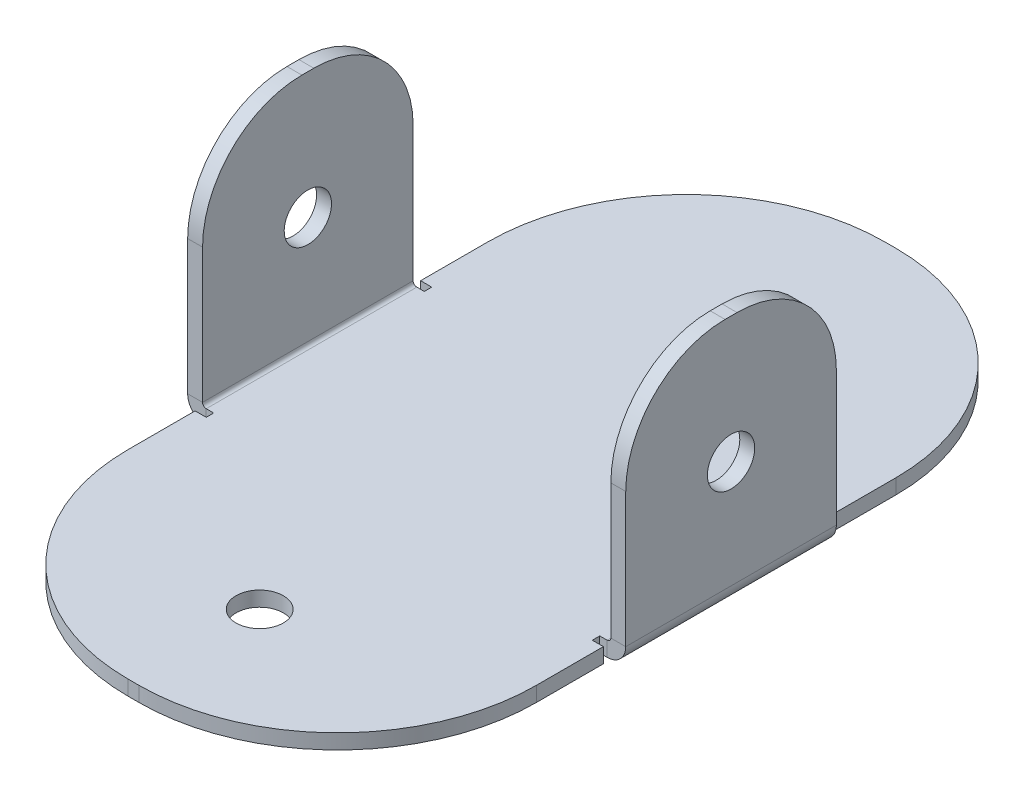
from build123d import *

# Parameters (mm, degrees)
SKETCH1_R                     = 4.7625
BASE_FLANGE1_DEPTH            = 3
EDGE_FLANGE2_STRIP_W          = 13.4732
EDGE_FLANGE2_STRIP_H          = 3
EDGE_FLANGE2_STRIP_CUT_DEPTH  = 42.4
EDGE_FLANGE2_RELIEF_W         = 14.9732
EDGE_FLANGE2_RELIEF_H         = 1.5
EDGE_FLANGE2_RELIEF_CUT_DEPTH = 3
EDGE_FLANGE2_DEPTH            = 42.4
EDGE_FLANGE2_START            = 3
EDGE_FLANGE2_PROFILE_R        = 4.7625
EDGE_FLANGE2_FLAT_DEPTH       = 3
EDGE_FLANGE3_STRIP_W          = 13.4732
EDGE_FLANGE3_STRIP_H          = 3
EDGE_FLANGE3_STRIP_CUT_DEPTH  = 42.4
EDGE_FLANGE3_RELIEF_W         = 14.9732
EDGE_FLANGE3_RELIEF_H         = 1.5
EDGE_FLANGE3_RELIEF_CUT_DEPTH = 3
EDGE_FLANGE3_DEPTH            = 42.4
EDGE_FLANGE3_START            = 3
EDGE_FLANGE3_PROFILE_R        = 4.7625
EDGE_FLANGE3_FLAT_DEPTH       = 3


# Sheet-metal steps are written as plain solids
with BuildPart() as part:
    # Sketch1 → Base-Flange1 (new body)
    with BuildSketch(Plane(origin=(0, 0, 0), x_dir=(1, 0, 0), z_dir=(0, 1, 0))):
        with BuildLine():
            Line((-1.1, 76.2), (1.1, 76.2))
            ThreePointArc((1.1, 76.2), (29.384271247, 64.484271247), (41.1, 36.2))
            Line((41.1, 36.2), (41.1, -36.2))
            ThreePointArc((41.1, -36.2), (29.384271247, -64.484271247), (1.1, -76.2))
            Line((1.1, -76.2), (-1.1, -76.2))
            ThreePointArc((-1.1, -76.2), (-29.384271247, -64.484271247), (-41.1, -36.2))
            Line((-41.1, -36.2), (-41.1, 36.2))
            ThreePointArc((-41.1, 36.2), (-29.384271247, 64.484271247), (-1.1, 76.2))
        make_face()
        with Locations(Location((0, -50.8, 0), (0, 0, 270))):
            Circle(SKETCH1_R, mode=Mode.SUBTRACT)
        with Locations(Location((0, 50.8, 0), (0, 0, 90))):
            Circle(SKETCH1_R, mode=Mode.SUBTRACT)
    extrude(amount=-BASE_FLANGE1_DEPTH)

    # Edge-Flange2 strip (across the edge) → Edge-Flange2 strip cut (cut)
    with BuildSketch(Plane(origin=(41.1, 0, 21.2), x_dir=(-1, 0, 0), z_dir=(0, 0, -1))):
        with Locations((-6, -1.5)):
            Rectangle(EDGE_FLANGE2_STRIP_W, EDGE_FLANGE2_STRIP_H)
    extrude(amount=EDGE_FLANGE2_STRIP_CUT_DEPTH, mode=Mode.SUBTRACT)

    # Edge-Flange2 relief (on the sheet) → Edge-Flange2 relief cut (cut)
    with BuildSketch(Plane(origin=(40.3634, 0, 21.2), x_dir=(-1, 0, 0), z_dir=(0, 1, 0))):
        with Locations((-5.9866, 0.75)):
            Rectangle(EDGE_FLANGE2_RELIEF_W, EDGE_FLANGE2_RELIEF_H)
        with Locations((-5.9866, -43.15)):
            Rectangle(EDGE_FLANGE2_RELIEF_W, EDGE_FLANGE2_RELIEF_H)
    extrude(amount=-EDGE_FLANGE2_RELIEF_CUT_DEPTH, mode=Mode.SUBTRACT)

    # Edge-Flange2 bend section (across the edge) → Edge-Flange2 (add)
    with BuildSketch(Plane(origin=(41.1, 0, 21.2), x_dir=(-1, 0, 0), z_dir=(0, 0, -1))):
        with BuildLine():
            Line((-3, 0.7366), (0, 0.7366))
            ThreePointArc((0, 0.7366), (0.215745145, 0.215745145), (0.7366, 0))
            Line((0.7366, 0), (0.7366, -3))
            ThreePointArc((0.7366, -3), (-1.905575199, -1.905575199), (-3, 0.7366))
        make_face()
    extrude(amount=EDGE_FLANGE2_DEPTH)

    # Edge-Flange2 profile (on flange) → Edge-Flange2 flat (add)
    with BuildSketch(Plane(origin=(41.1, 0, 0), x_dir=(0, 0, -1), z_dir=(1, 0, 0)).offset(EDGE_FLANGE2_START)):
        with BuildLine():
            Line((-21.2, 27.8), (-21.2, 0.7366))
            Line((-21.2, 0.7366), (21.2, 0.7366))
            Line((21.2, 0.7366), (21.2, 27.8))
            ThreePointArc((21.2, 27.8), (15.342135624, 41.942135624), (1.2, 47.8))
            Line((1.2, 47.8), (-1.2, 47.8))
            ThreePointArc((-1.2, 47.8), (-15.342135624, 41.942135624), (-21.2, 27.8))
        make_face()
        with Locations((0, 22.4)):
            Circle(EDGE_FLANGE2_PROFILE_R, mode=Mode.SUBTRACT)
    extrude(amount=-EDGE_FLANGE2_FLAT_DEPTH)

    # Edge-Flange3 strip (across the edge) → Edge-Flange3 strip cut (cut)
    with BuildSketch(Plane(origin=(-41.1, 0, -21.2), x_dir=(1, 0, 0), z_dir=(0, 0, 1))):
        with Locations((-6, -1.5)):
            Rectangle(EDGE_FLANGE3_STRIP_W, EDGE_FLANGE3_STRIP_H)
    extrude(amount=EDGE_FLANGE3_STRIP_CUT_DEPTH, mode=Mode.SUBTRACT)

    # Edge-Flange3 relief (on the sheet) → Edge-Flange3 relief cut (cut)
    with BuildSketch(Plane(origin=(-40.3634, 0, -21.2), x_dir=(1, 0, 0), z_dir=(0, 1, 0))):
        with Locations((-5.9866, 0.75)):
            Rectangle(EDGE_FLANGE3_RELIEF_W, EDGE_FLANGE3_RELIEF_H)
        with Locations((-5.9866, -43.15)):
            Rectangle(EDGE_FLANGE3_RELIEF_W, EDGE_FLANGE3_RELIEF_H)
    extrude(amount=-EDGE_FLANGE3_RELIEF_CUT_DEPTH, mode=Mode.SUBTRACT)

    # Edge-Flange3 bend section (across the edge) → Edge-Flange3 (add)
    with BuildSketch(Plane(origin=(-41.1, 0, -21.2), x_dir=(1, 0, 0), z_dir=(0, 0, 1))):
        with BuildLine():
            Line((-3, 0.7366), (0, 0.7366))
            ThreePointArc((0, 0.7366), (0.215745145, 0.215745145), (0.7366, 0))
            Line((0.7366, 0), (0.7366, -3))
            ThreePointArc((0.7366, -3), (-1.905575199, -1.905575199), (-3, 0.7366))
        make_face()
    extrude(amount=EDGE_FLANGE3_DEPTH)

    # Edge-Flange3 profile (on flange) → Edge-Flange3 flat (add)
    with BuildSketch(Plane.ZY.offset(41.1).offset(EDGE_FLANGE3_START)):
        with BuildLine():
            Line((-21.2, 27.8), (-21.2, 0.7366))
            Line((-21.2, 0.7366), (21.2, 0.7366))
            Line((21.2, 0.7366), (21.2, 27.8))
            ThreePointArc((21.2, 27.8), (15.342135624, 41.942135624), (1.2, 47.8))
            Line((1.2, 47.8), (-1.2, 47.8))
            ThreePointArc((-1.2, 47.8), (-15.342135624, 41.942135624), (-21.2, 27.8))
        make_face()
        with Locations((0, 22.4)):
            Circle(EDGE_FLANGE3_PROFILE_R, mode=Mode.SUBTRACT)
    extrude(amount=-EDGE_FLANGE3_FLAT_DEPTH)


solid = part.part
